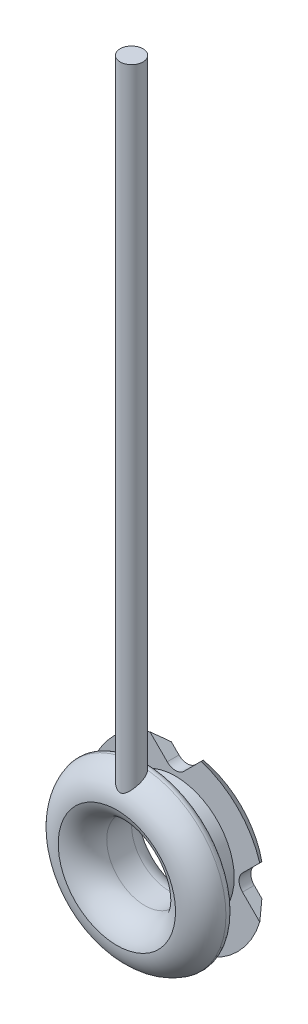
from build123d import *

# Parameters (mm, degrees)
SKETCH1_R           = 1
SKETCH1_R_2         = 0.65
BOSS_EXTRUDE1_DEPTH = 0.5
SKETCH3_R           = 1.5
SKETCH3_R_2         = 0.65
BOSS_EXTRUDE4_DEPTH = 0.5
BOSS_EXTRUDE5_START = 0.2
SKETCH4_R           = 0.65
BOSS_EXTRUDE5_DEPTH = 0.2
FILLET4_R           = 0.5
FILLET5_R           = 0.5
FILLET6_R           = 0.1
CHAMFER2_SIZE       = 0.2
FILLET8_R           = 0.2
FILLET9_R           = 0.1
FILLET10_R          = 0.3
SKETCH6_R           = 0.195


# Some blends are built 0.0001 mm under size
with BuildPart() as part:
    # Sketch1 → Boss-Extrude1 (new body)
    with BuildSketch(Plane.XY):
        Circle(SKETCH1_R)
        Circle(SKETCH1_R_2, mode=Mode.SUBTRACT)
    extrude(amount=BOSS_EXTRUDE1_DEPTH)

    # Sketch3 → Boss-Extrude4 (add)
    with BuildSketch(Plane.XY.offset(0.5)):
        Circle(SKETCH3_R)
        Circle(SKETCH3_R_2, mode=Mode.SUBTRACT)
    extrude(amount=BOSS_EXTRUDE4_DEPTH)

    # Sketch4 → Boss-Extrude5 (add)
    with BuildSketch(Plane(origin=(0, 0, 0), x_dir=(-1, 0, 0), z_dir=(0, 0, -1)).offset(BOSS_EXTRUDE5_START)):
        with BuildLine():
            Line((0, 1), (-0.435414347, 1.435414347))
            ThreePointArc((-0.435414347, 1.435414347), (-1.060660172, 1.060660172), (-1.435414347, 0.435414347))
            Line((-1.435414347, 0.435414347), (-1, 0))
            Line((-1, 0), (-1.435414347, -0.435414347))
            ThreePointArc((-1.435414347, -0.435414347), (-1.060660172, -1.060660172), (-0.435414347, -1.435414347))
            Line((-0.435414347, -1.435414347), (0, -1))
            Line((0, -1), (0.435414347, -1.435414347))
            ThreePointArc((0.435414347, -1.435414347), (1.060660172, -1.060660172), (1.435414347, -0.435414347))
            Line((1.435414347, -0.435414347), (1, 0))
            Line((1, 0), (1.435414347, 0.435414347))
            ThreePointArc((1.435414347, 0.435414347), (1.060660172, 1.060660172), (0.435414347, 1.435414347))
            Line((0.435414347, 1.435414347), (0, 1))
        make_face()
        Circle(SKETCH4_R, mode=Mode.SUBTRACT)
    extrude(amount=-BOSS_EXTRUDE5_DEPTH)

    # Fillet4
    fillet4_edges = [part.edges().sort_by_distance(p)[0] for p in [
        (-1.5, 0, 1),
    ]]
    fillet(fillet4_edges, radius=FILLET4_R - 0.0001)  # a hair under: the kernel refuses the full size

    # Fillet5
    # the kernel refuses this fillet: 0.5 mm, written as the material it takes off along each edge
    with BuildSketch(Plane(origin=(0, 0, 1), x_dir=(1, 0, 0), z_dir=(0, -1, 0))) as fillet5_piece_1:
        with BuildLine():
            CenterArc((1.15, -0.477001038), FILLET5_R, 107.44559106, 72.55440894)
            Line((0.65, -0.477001038), (0.64, -0.477001038))
            Line((0.64, -0.477001038), (0.64, 0))
            Line((0.64, 0), (0.65, 0.01))
            ThreePointArc((0.65, 0.01), (0.82505, 0.01), (0.997102, 0.009540021))
            Line((0.997102, 0.009540021), (1.0001, 0))
        make_face()
    revolve(axis=Axis((0, 0, 1), (0, 0, 1)), mode=Mode.SUBTRACT)

    # Fillet6
    fillet6_edges = [part.edges().sort_by_distance(p)[0] for p in [
        (-1.5, 0, 0.5),
    ]]
    fillet(fillet6_edges, radius=FILLET6_R)

    # Chamfer2
    chamfer2_edges = [part.edges().sort_by_distance(p)[0] for p in [
        (-1.060660172, -1.060660172, -0.2),
        (-1.060660172, 1.060660172, -0.2),
        (1.060660172, 1.060660172, -0.2),
        (1.060660172, -1.060660172, -0.2),
    ]]
    chamfer(chamfer2_edges, length=CHAMFER2_SIZE - 0.0001)  # a hair under: the kernel refuses the full size

    # Fillet8
    # the kernel refuses this fillet: 0.2 mm, written as the material it adds along each edge
    with BuildSketch(Plane(origin=(0, 1, -0.2), x_dir=(-0.7071067811865487, 0.7071067811865465, 0), z_dir=(0, 0, 1)), Plane(origin=(-1, 0, -0.2), x_dir=(-0.7071067811865464, -0.7071067811865487, 0), z_dir=(0, 0, 1))) as fillet8_piece_1:
        with BuildLine():
            CenterArc((FILLET8_R, -FILLET8_R), FILLET8_R, 90, 90)
            Line((0, -FILLET8_R), (0, 0))
            Line((0, 0), (FILLET8_R, 0))
        make_face()
    extrude(amount=0.2)
    with BuildSketch(Plane(origin=(1, 0, -0.2), x_dir=(0.707106781186541, -0.707106781186554, 0), z_dir=(0, 0, 1)), Plane(origin=(0, -1, -0.2), x_dir=(-0.707106781186554, -0.707106781186541, 0), z_dir=(0, 0, 1))) as fillet8_piece_2:
        with BuildLine():
            CenterArc((FILLET8_R, FILLET8_R), FILLET8_R, 180, 90)
            Line((0, FILLET8_R), (0, 0))
            Line((0, 0), (FILLET8_R, 0))
        make_face()
    extrude(amount=0.2)

    # Fillet9
    fillet9_edges = [part.edges().sort_by_distance(p)[0] for p in [
        (-0.919309526, -0.919309526, -0.2),
    ]]
    fillet(fillet9_edges, radius=FILLET9_R)

    # Fillet10
    # the kernel refuses this fillet: 0.3 mm, written as the material it takes off along each edge
    with BuildSketch(Plane(origin=(0, 0, -0.2), x_dir=(-1, 0, 0), z_dir=(0, -1, 0))) as fillet10_piece_1:
        with BuildLine():
            CenterArc((0.65 + FILLET10_R, -FILLET10_R), FILLET10_R, 90, 90)
            Line((0.65, -FILLET10_R), (0.65, 0))
            Line((0.65, 0), (0.65 + FILLET10_R, 0))
        make_face()
    revolve(axis=Axis((0, 0, -0.2), (0, 0, -1)), mode=Mode.SUBTRACT)

    # Sweep2: sweep along a path in Sketch5
    with BuildLine(Plane.XY.offset(0.75)) as sweep2_path:
        Line((0, 1), (0, 12.016341366))
    # Sketch6 → Sweep2 (sweep)
    with BuildSketch(Plane(origin=(0, 1, 0), x_dir=(1, 0, 0), z_dir=(0, 1, 0))):
        with Locations((0, -0.75)):
            Circle(SKETCH6_R)
    sweep(path=sweep2_path.line)


solid = part.part
